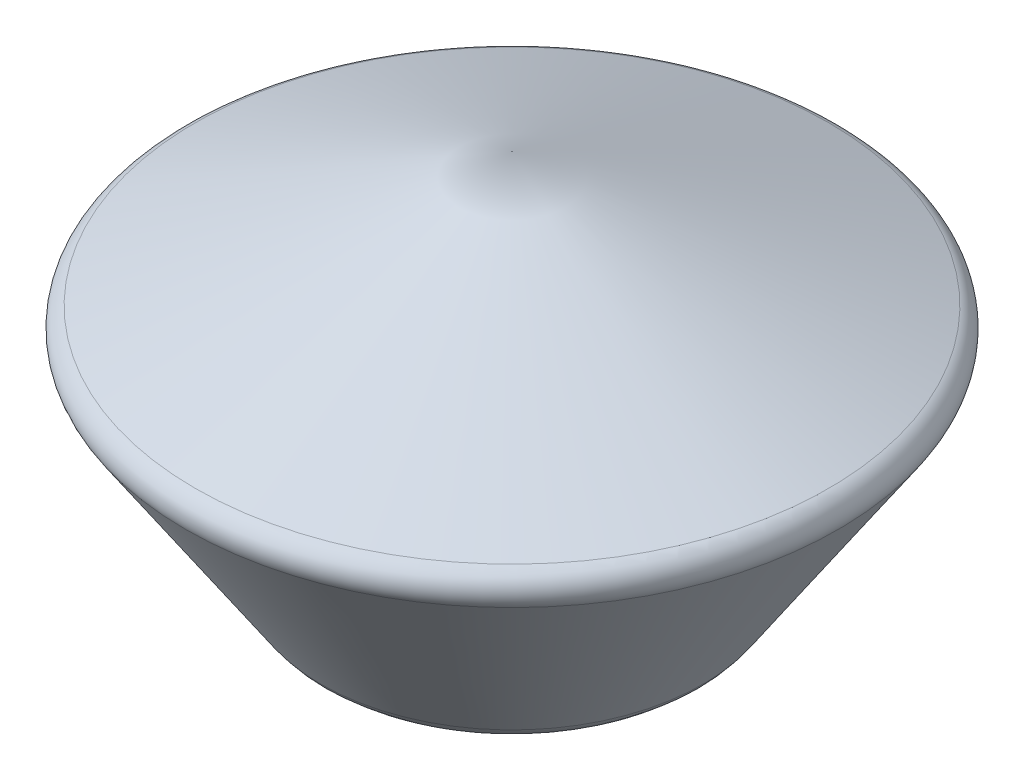
from build123d import *

# Parameters (mm, degrees)
INTERSECT2_START       = 262.147801711
INTERSECT2_3_OUTLINE_W = 788
INTERSECT2_3_OUTLINE_H = 788
INTERSECT2_3_DEPTH     = 195.887953468


# Read off the part's stored shape, not the designer's step: Intersect2
with BuildPart() as part:
    # Sketch1 → Revolve1 (revolve)
    with BuildSketch(Plane.XY, mode=Mode.PRIVATE) as revolve1_sk:
        with BuildLine():
            Line((0, 0), (-185.603847806, 0))
            ThreePointArc((-185.603847806, 0), (-209.13457331, 5.883053628), (-227.127998013, 22.147801711))
            Line((-227.127998013, 22.147801711), (-388.107272869, 262.147801711))
            ThreePointArc((-388.107272869, 262.147801711), (-391.297426344, 283.235656654), (-377.055159153, 299.111189104))
            Line((-377.055159153, 299.111189104), (0, 458.035755079))
            Line((0, 458.035755079), (0, 442.968894339))
            Line((0, 442.968894339), (-10, 442.968894339))
            Line((-10, 442.968894339), (-373.171174598, 289.896273805))
            ThreePointArc((-373.171174598, 289.896273805), (-381.716534912, 280.370954335), (-379.802442828, 267.718241369))
            Line((-379.802442828, 267.718241369), (-218.823167972, 27.718241369))
            ThreePointArc((-218.823167972, 27.718241369), (-204.42842821, 14.706442902), (-185.603847806, 10))
            Line((-185.603847806, 10), (-10, 10))
            Line((-10, 10), (0, 10))
            Line((0, 10), (0, 0))
        make_face()
    revolve(revolve1_sk.sketch.rotate(Axis((0, 599.304151963, 0), (0, -1, 0)), 270), axis=Axis((0, 599.304151963, 0), (0, -1, 0)))

    # Intersect2 3 outline → Intersect2 3 (cut)
    with BuildSketch(Plane(origin=(0, 0, 0), x_dir=(1, 0, 0), z_dir=(0, 1, 0)).offset(INTERSECT2_START)):
        Rectangle(INTERSECT2_3_OUTLINE_W, INTERSECT2_3_OUTLINE_H)
    extrude(amount=INTERSECT2_3_DEPTH, mode=Mode.SUBTRACT)


with BuildPart() as body_2:
    # Intersect2 outline → Intersect2 (revolve)
    with BuildSketch(Plane.XY):
        with BuildLine():
            Line((379.802442828, 267.718241369), (376.066087258, 262.147801711))
            Line((376.066087258, 262.147801711), (388.107272869, 262.147801711))
            ThreePointArc((388.107272869, 262.147801711), (391.297426344, 283.235656654), (377.055159153, 299.111189104))
            Line((377.055159153, 299.111189104), (0, 458.035755079))
            Line((0, 458.035755079), (0, 442.968894339))
            Line((0, 442.968894339), (10, 442.968894339))
            Line((10, 442.968894339), (373.171174598, 289.896273805))
            ThreePointArc((373.171174598, 289.896273805), (381.716534912, 280.370954335), (379.802442828, 267.718241369))
        make_face()
    revolve(axis=Axis((0, 0, 0), (0, 1, 0)))


with BuildPart() as body_3:
    # Intersect2 2 outline → Intersect2 2 (revolve)
    with BuildSketch(Plane.XY):
        with BuildLine():
            Line((0, 262.147801711), (376.066087258, 262.147801711))
            Line((376.066087258, 262.147801711), (379.802442828, 267.718241369))
            ThreePointArc((379.802442828, 267.718241369), (381.716534912, 280.370954335), (373.171174598, 289.896273805))
            Line((373.171174598, 289.896273805), (10, 442.968894339))
            Line((10, 442.968894339), (0, 442.968894339))
            Line((0, 442.968894339), (0, 262.147801711))
        make_face()
    revolve(axis=Axis((0, 0, 0), (0, 1, 0)))


with BuildPart() as body_4:
    # Intersect2 4 outline → Intersect2 4 (revolve)
    with BuildSketch(Plane.XY):
        with BuildLine():
            Line((0, 262.147801711), (0, 10))
            Line((0, 10), (185.603847806, 10))
            ThreePointArc((185.603847806, 10), (204.42842821, 14.706442902), (218.823167972, 27.718241369))
            Line((218.823167972, 27.718241369), (376.066087258, 262.147801711))
            Line((376.066087258, 262.147801711), (0, 262.147801711))
        make_face()
    revolve(axis=Axis((0, 0, 0), (0, 1, 0)))


solid = Compound([part.part, body_2.part, body_3.part, body_4.part])
